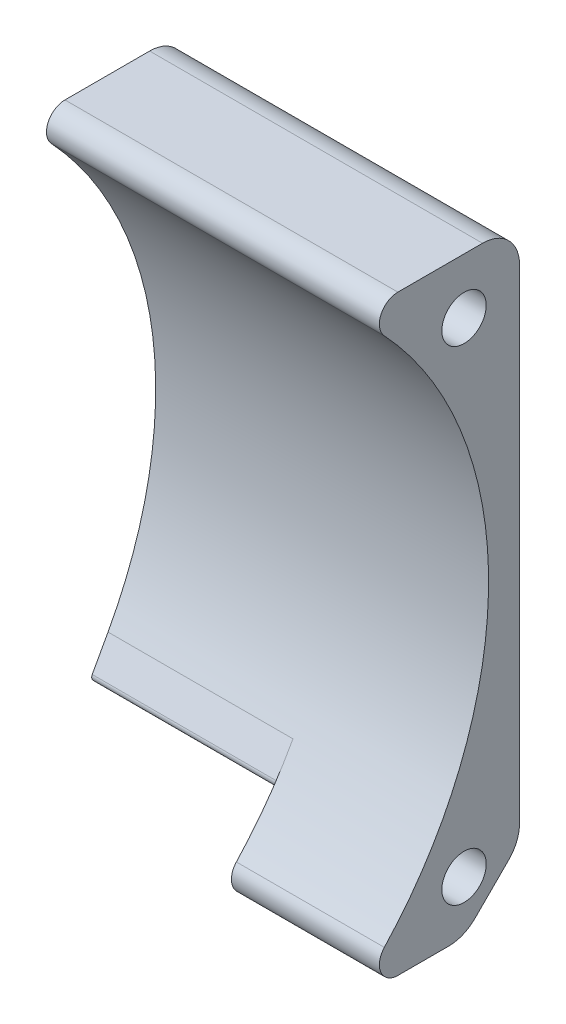
from build123d import *

# Parameters (mm, degrees)
BOSS_EXTRUDE1_DEPTH = 28.575
CHAMFER1_SIZE       = 4.7625
FILLET3_R           = 3.175
CUT_EXTRUDE1_START  = -12.7
CUT_EXTRUDE1_DEPTH  = 48.337684469
FILLET4_R           = 0.396875
FILLET5_R           = 3.175
FILLET6_R           = 1.5875
SKETCH3_R           = 1.905
CUT_EXTRUDE2_DEPTH  = 60.514034165


with BuildPart() as part:
    # Sketch1 → Boss-Extrude1 (new body)
    with BuildSketch(Plane(origin=(0, 0, 0), x_dir=(0, 0, -1), z_dir=(1, 0, 0))):
        with BuildLine():
            Line((0, 0), (-14.399754562, 0))
            ThreePointArc((-14.399754562, 0), (-2.654588994, -25.4), (-14.399754562, -50.8))
            Line((-14.399754562, -50.8), (0, -50.8))
            Line((0, -50.8), (0, 0))
        make_face()
    extrude(amount=BOSS_EXTRUDE1_DEPTH)

    # Chamfer1
    chamfer1_edges = [part.edges().sort_by_distance(p)[0] for p in [
        (14.2875, -50.8, 0),
    ]]
    chamfer(chamfer1_edges, length=CHAMFER1_SIZE)

    # Fillet3
    fillet3_edges = [part.edges().sort_by_distance(p)[0] for p in [
        (14.2875, -50.8, 4.7625),
        (14.2875, -46.0375, 0),
    ]]
    fillet(fillet3_edges, radius=FILLET3_R)

    # Sketch2 → Cut-Extrude1 (cut, through all)
    with BuildSketch(Plane(origin=(28.575, 0, 0), x_dir=(0, 0, -1), z_dir=(1, 0, 0)).offset(CUT_EXTRUDE1_START)):
        with BuildLine():
            Line((-9.432233183, -46.30987194), (-6.747973263, -41.405330404))
            ThreePointArc((-6.747973263, -41.405330404), (-10.143469679, -46.453213193), (-14.399754562, -50.8))
            Line((-14.399754562, -50.8), (-6.077628061, -50.8))
            ThreePointArc((-6.077628061, -50.8), (-4.862608163, -50.558317516), (-3.83256403, -49.87006403))
            Line((-3.83256403, -49.87006403), (-0.92993597, -46.96743597))
            ThreePointArc((-0.92993597, -46.96743597), (-0.583051244, -46.556064021), (-0.31061766, -46.092021096))
            Line((-0.31061766, -46.092021096), (-4.7625, -41.640138757))
            Line((-4.7625, -41.640138757), (-9.432233183, -46.30987194))
        make_face()
    extrude(amount=-CUT_EXTRUDE1_DEPTH, mode=Mode.SUBTRACT)

    # Fillet4
    fillet4_edges = [part.edges().sort_by_distance(p)[0] for p in [
        (7.9375, -46.30987194, 9.432233183),
    ]]
    fillet(fillet4_edges, radius=FILLET4_R)

    # Fillet5
    fillet5_edges = [part.edges().sort_by_distance(p)[0] for p in [
        (14.2875, 0, 0),
    ]]
    fillet(fillet5_edges, radius=FILLET5_R)

    # Fillet6
    fillet6_edges = [part.edges().sort_by_distance(p)[0] for p in [
        (22.225, -50.8, 14.399754562),
        (14.2875, 0, 14.399754562),
    ]]
    fillet(fillet6_edges, radius=FILLET6_R)

    # Sketch3 → Cut-Extrude2 (cut, through all)
    with BuildSketch(Plane(origin=(28.575, 0, 0), x_dir=(0, 0, -1), z_dir=(1, 0, 0))):
        with Locations((-4.7625, -4.7625)):
            Circle(SKETCH3_R)
        with Locations((-4.7625, -46.309871939)):
            Circle(SKETCH3_R)
    extrude(amount=-CUT_EXTRUDE2_DEPTH, mode=Mode.SUBTRACT)


solid = part.part
